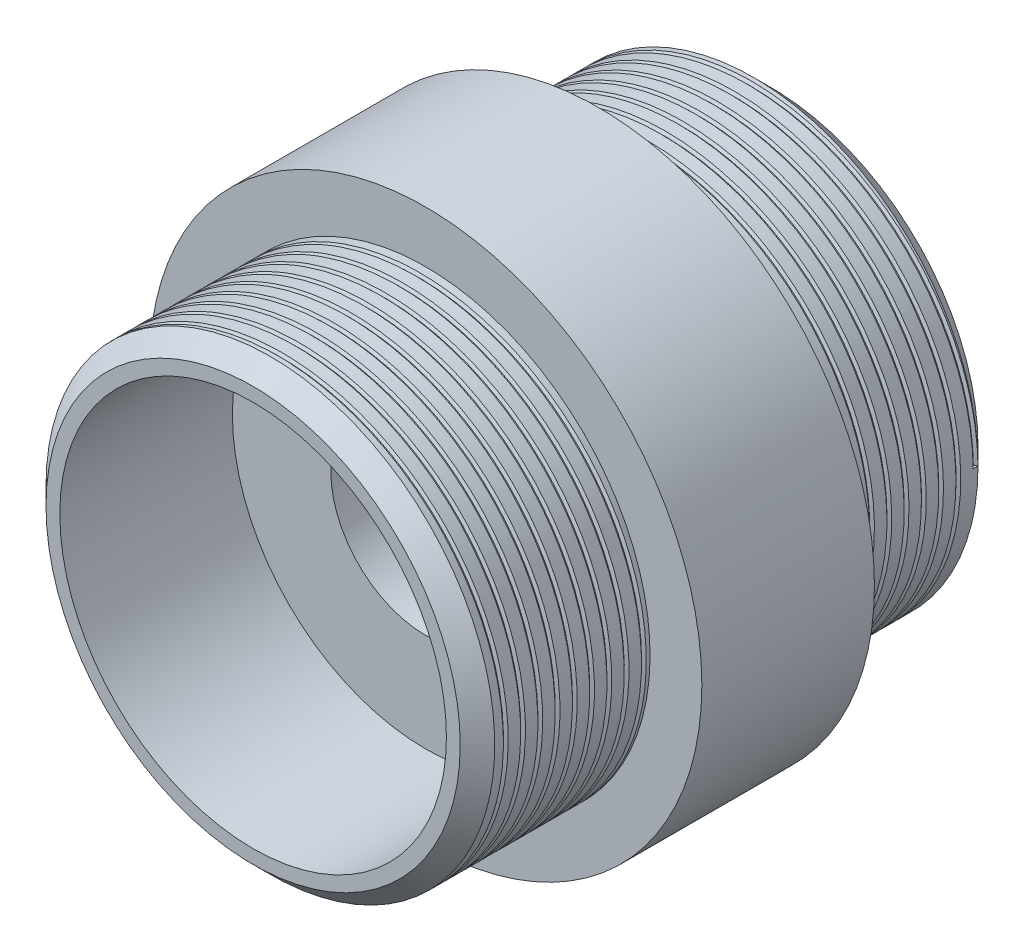
from build123d import *

# Parameters (mm, degrees)
IZIM1_R                     = 13
Y_KSEKLIK_EKSTR_ZYON1_DEPTH = 10
IZIM2_R                     = 16
Y_KSEKLIK_EKSTR_ZYON2_DEPTH = 10
IZIM3_R                     = 13
Y_KSEKLIK_EKSTR_ZYON3_DEPTH = 10
PAH1_SIZE                   = 1
DI_1_PITCH                  = 1
DI_2_PITCH                  = 1
IZIM4_R                     = 11.2
KES_EKSTR_ZYON1_DEPTH       = 10
KES_EKSTR_ZYON2_START       = -10
IZIM5_R                     = 11.2
KES_EKSTR_ZYON2_DEPTH       = 10
IZIM6_R                     = 5.5
KES_EKSTR_ZYON3_DEPTH       = 32
IZIM7_R                     = 1
KES_EKSTR_ZYON4_DEPTH       = 8


with BuildPart() as part:
    # Çizim1 → Yükseklik-Ekstrüzyon1 (new body)
    with BuildSketch(Plane.XY):
        Circle(IZIM1_R)
    extrude(amount=Y_KSEKLIK_EKSTR_ZYON1_DEPTH)

    # Çizim2 → Yükseklik-Ekstrüzyon2 (add)
    with BuildSketch(Plane.XY.offset(10)):
        Circle(IZIM2_R)
    extrude(amount=Y_KSEKLIK_EKSTR_ZYON2_DEPTH)

    # Çizim3 → Yükseklik-Ekstrüzyon3 (add)
    with BuildSketch(Plane.XY.offset(20)):
        Circle(IZIM3_R)
    extrude(amount=Y_KSEKLIK_EKSTR_ZYON3_DEPTH)

    # Pah1
    pah1_edges = [part.edges().sort_by_distance(p)[0] for p in [
        (-13, 0, 30),
        (-13, 0, 0),
    ]]
    chamfer(pah1_edges, length=PAH1_SIZE)

    # Diş1: the profile of Diş Profili1 profile screwed along a right-hand helix of 10 turns, 8 arcs to a turn; built about Z, then put on its axis
    di_1_z = Axis((0, 0, 0), (0, 0, 1))
    di_1_corners = [(13.0003, 0, -0.000173205), (13.0003, 0, 0.277985704), (12.828148085, 0, 0.17859375), (12.828148085, 0, 0.09921875)]
    with BuildLine(mode=Mode.PRIVATE) as di_1_profile:
        Line(di_1_corners[0], di_1_corners[1])
        Line(di_1_corners[1], di_1_corners[2])
        Line(di_1_corners[2], di_1_corners[3])
        Line(di_1_corners[3], di_1_corners[0])
    di_1_cap = Face(di_1_profile.wire())
    di_1_turn_angles = [0, 22.5, 45, 67.5, 90, 112.5, 135, 157.5, 180, 202.5, 225, 247.5, 270, 292.5, 315, 337.5, 360]
    di_1_turn_weights = [1, 0.9238795325112867, 1, 0.9238795325112867, 1, 0.9238795325112867, 1, 0.9238795325112867, 1, 0.9238795325112867, 1, 0.9238795325112867, 1, 0.9238795325112867, 1, 0.9238795325112867, 1]
    di_1_turn_rails = [Edge.make_bspline([Vector(p[0], p[1], 0).rotate(di_1_z, di_1_turn_angles[k]) / di_1_turn_weights[k] + Vector(0, 0, p[2] + DI_1_PITCH * di_1_turn_angles[k] / 360) for k in range(17)], [0, 0, 0, 1, 1, 2, 2, 3, 3, 4, 4, 5, 5, 6, 6, 7, 7, 8, 8, 8], 2, di_1_turn_weights) for p in di_1_corners]
    di_1_turn_sides = [Face.make_surface_from_curves(di_1_turn_rails[p[0]], di_1_turn_rails[p[1]]) for p in [(0, 1), (1, 2), (2, 3), (3, 0)]]
    di_1 = Plane(origin=(0, 0, 1), x_dir=(1, 0, 0), z_dir=(0, 0, 1)) * Solid(Shell([*[p.moved(Location((0, 0, DI_1_PITCH * i))) for i in range(10) for p in di_1_turn_sides], di_1_cap, di_1_cap.rotate(di_1_z, 3600).moved(Location((0, 0, DI_1_PITCH * 3600 / 360)))]))
    add(di_1, mode=Mode.SUBTRACT)

    # Diş2: the profile of Diş Profili2 profile screwed along a right-hand helix of 10 turns, 8 arcs to a turn; built about Z, then put on its axis
    di_2_z = Axis((0, 0, 0), (0, 0, 1))
    di_2_corners = [(13.0003, 0, -0.000173205), (13.0003, 0, 0.277985704), (12.828148085, 0, 0.17859375), (12.828148085, 0, 0.09921875)]
    with BuildLine(mode=Mode.PRIVATE) as di_2_profile:
        Line(di_2_corners[0], di_2_corners[1])
        Line(di_2_corners[1], di_2_corners[2])
        Line(di_2_corners[2], di_2_corners[3])
        Line(di_2_corners[3], di_2_corners[0])
    di_2_cap = Face(di_2_profile.wire())
    di_2_turn_angles = [0, 22.5, 45, 67.5, 90, 112.5, 135, 157.5, 180, 202.5, 225, 247.5, 270, 292.5, 315, 337.5, 360]
    di_2_turn_weights = [1, 0.9238795325112867, 1, 0.9238795325112867, 1, 0.9238795325112867, 1, 0.9238795325112867, 1, 0.9238795325112867, 1, 0.9238795325112867, 1, 0.9238795325112867, 1, 0.9238795325112867, 1]
    di_2_turn_rails = [Edge.make_bspline([Vector(p[0], p[1], 0).rotate(di_2_z, di_2_turn_angles[k]) / di_2_turn_weights[k] + Vector(0, 0, p[2] + DI_2_PITCH * di_2_turn_angles[k] / 360) for k in range(17)], [0, 0, 0, 1, 1, 2, 2, 3, 3, 4, 4, 5, 5, 6, 6, 7, 7, 8, 8, 8], 2, di_2_turn_weights) for p in di_2_corners]
    di_2_turn_sides = [Face.make_surface_from_curves(di_2_turn_rails[p[0]], di_2_turn_rails[p[1]]) for p in [(0, 1), (1, 2), (2, 3), (3, 0)]]
    di_2 = Plane(origin=(0, 0, 29), x_dir=(-1, 0, 0), z_dir=(0, 0, -1)) * Solid(Shell([*[p.moved(Location((0, 0, DI_2_PITCH * i))) for i in range(10) for p in di_2_turn_sides], di_2_cap, di_2_cap.rotate(di_2_z, 3600).moved(Location((0, 0, DI_2_PITCH * 3600 / 360)))]))
    add(di_2, mode=Mode.SUBTRACT)

    # Çizim4 → Kes-Ekstrüzyon1 (cut)
    with BuildSketch(Plane.XY.offset(30)):
        Circle(IZIM4_R)
    extrude(amount=-KES_EKSTR_ZYON1_DEPTH, mode=Mode.SUBTRACT)

    # Çizim5 → Kes-Ekstrüzyon2 (cut)
    with BuildSketch(Plane(origin=(0, 0, 0), x_dir=(-1, 0, 0), z_dir=(0, 0, -1)).offset(KES_EKSTR_ZYON2_START)):
        with Locations(Location((0, 0, 0), (0, 0, 180))):
            Circle(IZIM5_R)
    extrude(amount=KES_EKSTR_ZYON2_DEPTH, mode=Mode.SUBTRACT)

    # Çizim6 → Kes-Ekstrüzyon3 (cut)
    with BuildSketch(Plane(origin=(0, 0, 10), x_dir=(-1, 0, 0), z_dir=(0, 0, -1))):
        Circle(IZIM6_R)
    extrude(amount=-KES_EKSTR_ZYON3_DEPTH, mode=Mode.SUBTRACT)

    # Çizim7 → Kes-Ekstrüzyon4 (cut)
    with BuildSketch(Plane(origin=(0, 0, 10), x_dir=(-1, 0, 0), z_dir=(0, 0, -1))):
        with Locations((0, 9.772133772)):
            Circle(IZIM7_R)
    extrude(amount=-KES_EKSTR_ZYON4_DEPTH, mode=Mode.SUBTRACT)


solid = part.part
